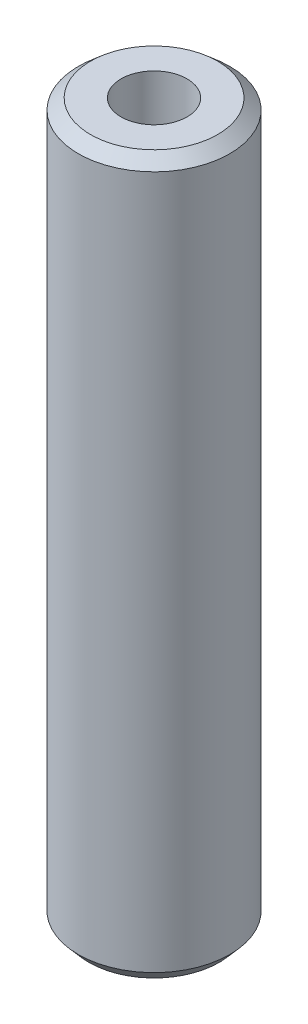
from build123d import *
from OCP.BRepFilletAPI import BRepFilletAPI_MakeChamfer

# Parameters (mm, degrees)
SKETCH1_R           = 22.5
BOSS_EXTRUDE1_DEPTH = 212.802195977
SKETCH2_R           = 9.807386953
CUT_EXTRUDE1_DEPTH  = 216.168014845
CHAMFER1_SIZE       = 3.133482959
CHAMFER1_SIZE2      = 3.60356856


with BuildPart() as part:
    # Sketch1 → Boss-Extrude1 (new body)
    with BuildSketch(Plane(origin=(0, 0, 0), x_dir=(1, 0, 0), z_dir=(0, 1, 0))):
        Circle(SKETCH1_R)
    extrude(amount=BOSS_EXTRUDE1_DEPTH)

    # Sketch2 → Cut-Extrude1 (cut, through all)
    with BuildSketch(Plane(origin=(0, 0, 0), x_dir=(1, 0, 0), z_dir=(0, 1, 0))):
        Circle(SKETCH2_R)
    extrude(amount=CUT_EXTRUDE1_DEPTH, mode=Mode.SUBTRACT)

    # Chamfer1: one chamfer whose edges measure the first distance from different faces: ONE call of the kernel's chamfer builder (chamfer() names one face for all edges)
    chamfer1_edges_1 = [part.edges().sort_by_distance(p)[0] for p in [
        (-22.5, 212.802195977, 0),
    ]]
    chamfer1_side_1 = [part.faces().sort_by_distance(p)[0] for p in [
        (-22.5, 106.401097988, 0),
    ]]
    chamfer1_edges_2 = [part.edges().sort_by_distance(p)[0] for p in [
        (-22.5, 0, 0),
    ]]
    chamfer1_side_2 = [part.faces().sort_by_distance(p)[0] for p in [
        (-21.863603897, 0, 0),
    ]]
    chamfer1 = BRepFilletAPI_MakeChamfer(part.part.solid().wrapped)
    for e in chamfer1_edges_1:
        chamfer1.Add(CHAMFER1_SIZE, CHAMFER1_SIZE2, e.wrapped, chamfer1_side_1[0].wrapped)  # the first distance lies on this face
    for e in chamfer1_edges_2:
        chamfer1.Add(CHAMFER1_SIZE, CHAMFER1_SIZE2, e.wrapped, chamfer1_side_2[0].wrapped)  # the first distance lies on this face
    add(Compound.cast(chamfer1.Shape()), mode=Mode.REPLACE)


solid = part.part
